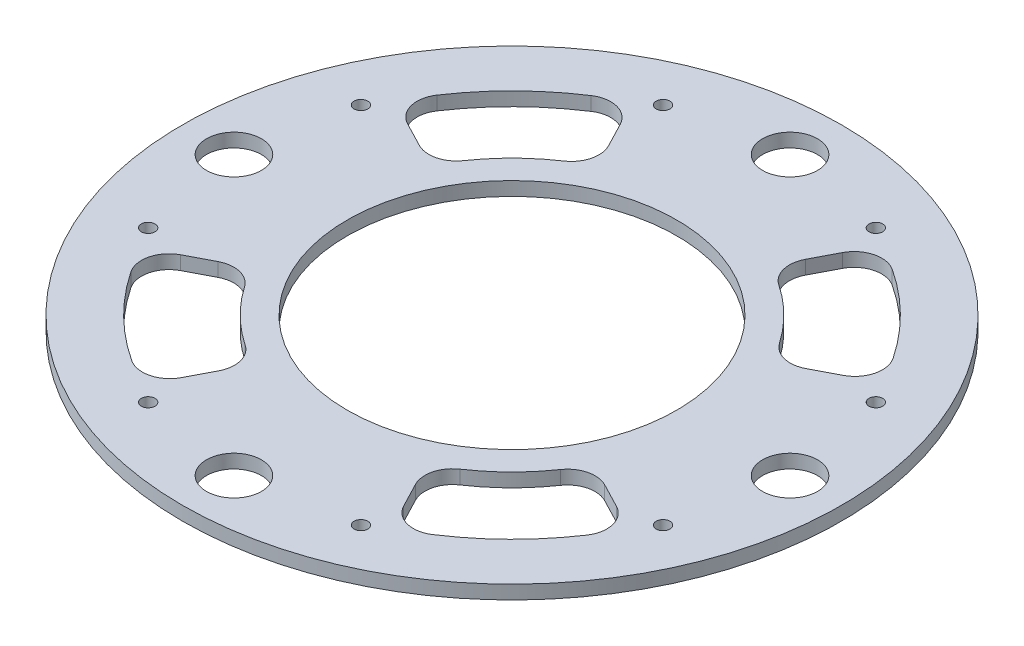
from build123d import *

# Parameters (mm, degrees)
SKETCH1_R           = 76.2
BOSS_EXTRUDE1_DEPTH = 3.175
SKETCH2_R           = 35
CUT_EXTRUDE1_DEPTH  = 6.35
SKETCH3_R           = 6.35
CUT_EXTRUDE2_DEPTH  = 10
SKETCH7_R           = 1.5875
CUT_EXTRUDE4_DEPTH  = 10
SKETCH8_R           = 6.35
CUT_EXTRUDE5_DEPTH  = 10
SKETCH9_R           = 38.1
CUT_EXTRUDE6_DEPTH  = 10
CUT_EXTRUDE10_DEPTH = 10


with BuildPart() as part:
    # Sketch1 → Boss-Extrude1 (new body)
    with BuildSketch(Plane(origin=(0, 0, 0), x_dir=(1, 0, 0), z_dir=(0, 1, 0))):
        Circle(SKETCH1_R)
    extrude(amount=BOSS_EXTRUDE1_DEPTH)

    # Sketch2 → Cut-Extrude1 (cut)
    with BuildSketch(Plane(origin=(0, 3.175, 0), x_dir=(1, 0, 0), z_dir=(0, 1, 0))):
        Circle(SKETCH2_R)
    extrude(amount=-CUT_EXTRUDE1_DEPTH, mode=Mode.SUBTRACT)

    # Sketch3 → Cut-Extrude2 (cut)
    with BuildSketch(Plane(origin=(0, 3.175, 0), x_dir=(1, 0, 0), z_dir=(0, 1, 0))):
        with Locations((-64.2875, 0)):
            Circle(SKETCH3_R)
        with Locations((64.2875, 0)):
            Circle(SKETCH3_R)
    extrude(amount=-CUT_EXTRUDE2_DEPTH, mode=Mode.SUBTRACT)

    # Sketch7 → Cut-Extrude4 (cut)
    with BuildSketch(Plane(origin=(0, 3.175, 0), x_dir=(1, 0, 0), z_dir=(0, 1, 0))):
        with Locations((-24.5999, 59.5249)):
            Circle(SKETCH7_R)
        with Locations((24.5999, 59.5249)):
            Circle(SKETCH7_R)
        with Locations((24.5999, -59.5249)):
            Circle(SKETCH7_R)
        with Locations((-24.5999, -59.5249)):
            Circle(SKETCH7_R)
        with Locations((-59.5249, 24.5999)):
            Circle(SKETCH7_R)
        with Locations((-59.5249, -24.5999)):
            Circle(SKETCH7_R)
        with Locations((59.5249, 24.5999)):
            Circle(SKETCH7_R)
        with Locations((59.5249, -24.5999)):
            Circle(SKETCH7_R)
    extrude(amount=-CUT_EXTRUDE4_DEPTH, mode=Mode.SUBTRACT)

    # Sketch8 → Cut-Extrude5 (cut)
    with BuildSketch(Plane(origin=(0, 3.175, 0), x_dir=(1, 0, 0), z_dir=(0, 1, 0))):
        with Locations((-64.2875, 0)):
            Circle(SKETCH8_R)
        with Locations((64.2875, 0)):
            Circle(SKETCH8_R)
        with Locations((0, -64.2875)):
            Circle(SKETCH8_R)
        with Locations((0, 64.2875)):
            Circle(SKETCH8_R)
    extrude(amount=-CUT_EXTRUDE5_DEPTH, mode=Mode.SUBTRACT)

    # Sketch9 → Cut-Extrude6 (cut)
    with BuildSketch(Plane(origin=(0, 3.175, 0), x_dir=(1, 0, 0), z_dir=(0, 1, 0))):
        Circle(SKETCH9_R)
    extrude(amount=-CUT_EXTRUDE6_DEPTH, mode=Mode.SUBTRACT)

    # Sketch10 → Cut-Extrude10 (cut)
    with BuildSketch(Plane(origin=(0, 3.175, 0), x_dir=(1, 0, 0), z_dir=(0, 1, 0))):
        with BuildLine():
            ThreePointArc((-24.830037796, 36.868302416), (-22.223123282, 40.56995153), (-22.744667262, 45.067306456))
            Line((-22.744667262, 45.067306456), (-25.69340518, 50.731779293))
            ThreePointArc((-25.69340518, 50.731779293), (-29.722021798, 53.943778286), (-34.806582189, 53.110750666))
            ThreePointArc((-34.806582189, 53.110750666), (-44.649726855, 45.151432888), (-52.718528787, 35.397834998))
            ThreePointArc((-52.718528787, 35.397834998), (-53.599643338, 30.28850003), (-50.378779602, 26.225532708))
            Line((-50.378779602, 26.225532708), (-44.706731925, 23.272851578))
            ThreePointArc((-44.706731925, 23.272851578), (-40.248145008, 22.741576978), (-36.552799702, 25.292199073))
            ThreePointArc((-36.552799702, 25.292199073), (-31.232430693, 31.628116811), (-24.830037796, 36.868302416))
        make_face()
        with BuildLine():
            ThreePointArc((36.552799702, 25.292199073), (40.248145008, 22.741576978), (44.706731925, 23.272851578))
            Line((44.706731925, 23.272851578), (50.378779602, 26.225532708))
            ThreePointArc((50.378779602, 26.225532708), (53.599643338, 30.28850003), (52.718528787, 35.397834998))
            ThreePointArc((52.718528787, 35.397834998), (44.649726855, 45.151432888), (34.806582189, 53.110750666))
            ThreePointArc((34.806582189, 53.110750666), (29.722021798, 53.943778286), (25.69340518, 50.731779293))
            Line((25.69340518, 50.731779293), (22.744667262, 45.067306456))
            ThreePointArc((22.744667262, 45.067306456), (22.223123282, 40.56995153), (24.830037796, 36.868302416))
            ThreePointArc((24.830037796, 36.868302416), (31.232430693, 31.628116811), (36.552799702, 25.292199073))
        make_face()
        with BuildLine():
            ThreePointArc((24.830037796, -36.868302416), (22.223123282, -40.56995153), (22.744667262, -45.067306456))
            Line((22.744667262, -45.067306456), (25.69340518, -50.731779293))
            ThreePointArc((25.69340518, -50.731779293), (29.722021798, -53.943778286), (34.806582189, -53.110750666))
            ThreePointArc((34.806582189, -53.110750666), (44.649726855, -45.151432888), (52.718528787, -35.397834998))
            ThreePointArc((52.718528787, -35.397834998), (53.599643338, -30.28850003), (50.378779602, -26.225532708))
            Line((50.378779602, -26.225532708), (44.706731925, -23.272851578))
            ThreePointArc((44.706731925, -23.272851578), (40.248145008, -22.741576978), (36.552799702, -25.292199073))
            ThreePointArc((36.552799702, -25.292199073), (31.232430693, -31.628116811), (24.830037796, -36.868302416))
        make_face()
        with BuildLine():
            ThreePointArc((-36.552799702, -25.292199073), (-40.248145008, -22.741576978), (-44.706731925, -23.272851578))
            Line((-44.706731925, -23.272851578), (-50.378779602, -26.225532708))
            ThreePointArc((-50.378779602, -26.225532708), (-53.599643338, -30.28850003), (-52.718528787, -35.397834998))
            ThreePointArc((-52.718528787, -35.397834998), (-44.649726855, -45.151432888), (-34.806582189, -53.110750666))
            ThreePointArc((-34.806582189, -53.110750666), (-29.722021798, -53.943778286), (-25.69340518, -50.731779293))
            Line((-25.69340518, -50.731779293), (-22.744667262, -45.067306456))
            ThreePointArc((-22.744667262, -45.067306456), (-22.223123282, -40.56995153), (-24.830037796, -36.868302416))
            ThreePointArc((-24.830037796, -36.868302416), (-31.232430693, -31.628116811), (-36.552799702, -25.292199073))
        make_face()
    extrude(amount=-CUT_EXTRUDE10_DEPTH, mode=Mode.SUBTRACT)


solid = part.part
